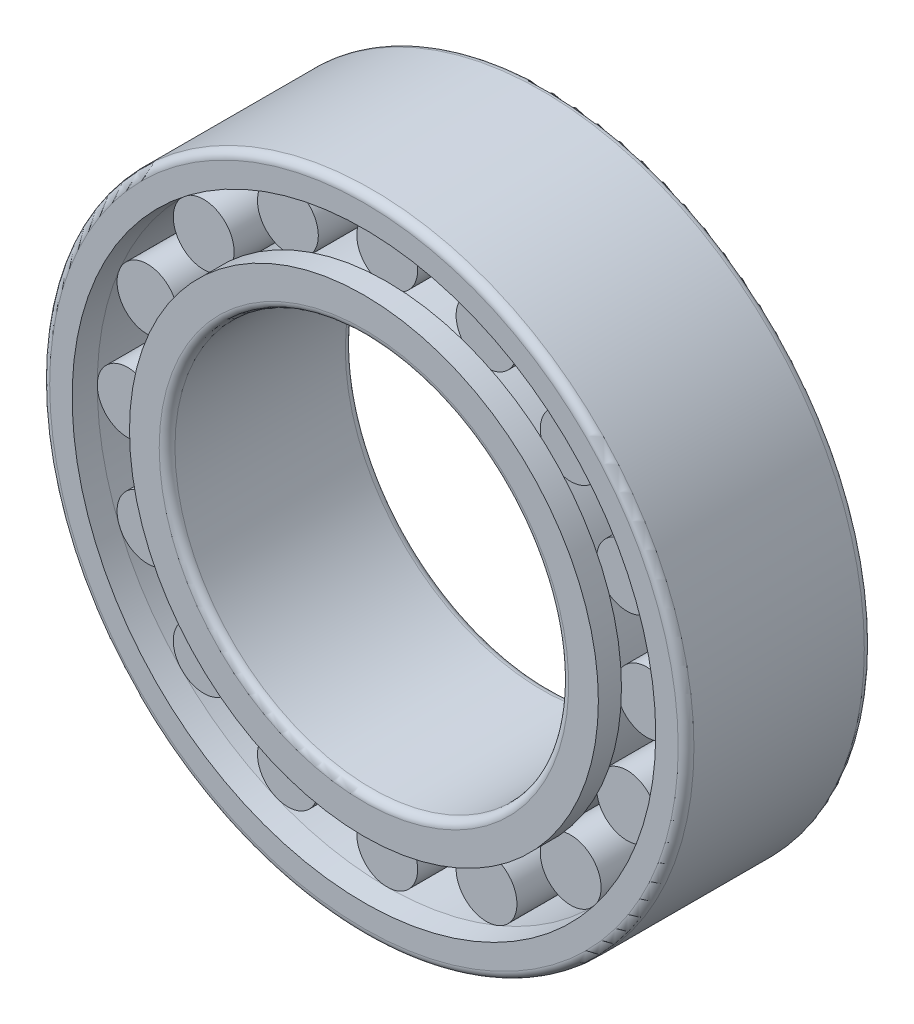
from build123d import *

# Parameters (mm, degrees)
BASESKE_W            = 8.45
BASESKE_H            = 4.25
FILLET1_R            = 1.1
CIRPATTERNBALL_COUNT = 16


with BuildPart() as part:
    # BaseSke → Roller (revolve)
    with BuildSketch(Plane(origin=(0, 0, 0), x_dir=(0, 0, -1), z_dir=(1, 0, 0))):
        with Locations((-5.525, 38.375)):
            Rectangle(BASESKE_W, BASESKE_H)
        with Locations((5.525, 38.375)):
            Rectangle(BASESKE_W, BASESKE_H)
    roller = revolve(axis=Axis((0, 36.25, 9.75), (0, 0, -1)))

    # OuterRaceSke → OuterRace (revolve)
    with BuildSketch(Plane(origin=(0, 0, 0), x_dir=(0, 0, -1), z_dir=(1, 0, 0))):
        Polygon((-13, 45), (13, 45), (13, 40.76215094), (9.775, 40.48), (-9.775, 40.48), (-13, 40.76215094), align=None)
    revolve(axis=Axis((0, 0, 50.391616343), (0, 0, -1)))

    # InnerRaceSke → InnerRace (revolve)
    with BuildSketch(Plane(origin=(0, 0, 0), x_dir=(0, 0, -1), z_dir=(1, 0, 0))):
        Polygon((-13, 27.5), (13, 27.5), (13, 32.75), (9.775, 32.75), (9.775, 32.02), (-9.775, 32.02), (-9.775, 32.75), (-13, 32.75), align=None)
    revolve(axis=Axis((0, 0, 70.862590906), (0, 0, -1)))

    # Fillet1
    fillet1_edges = [part.edges().sort_by_distance(p)[0] for p in [
        (0, -27.5, 13),
        (0, -45, -13),
        (0, -45, 13),
        (0, -27.5, -13),
    ]]
    fillet(fillet1_edges, radius=FILLET1_R)

    # CirPatternBall: Roller ×16 about axis
    cirpatternball_axis = Axis((0, 0, 50.391616343), (0, 0, -1))
    for i in range(1, CIRPATTERNBALL_COUNT):
        add(roller.rotate(cirpatternball_axis, i * 360 / CIRPATTERNBALL_COUNT))


solid = part.part
